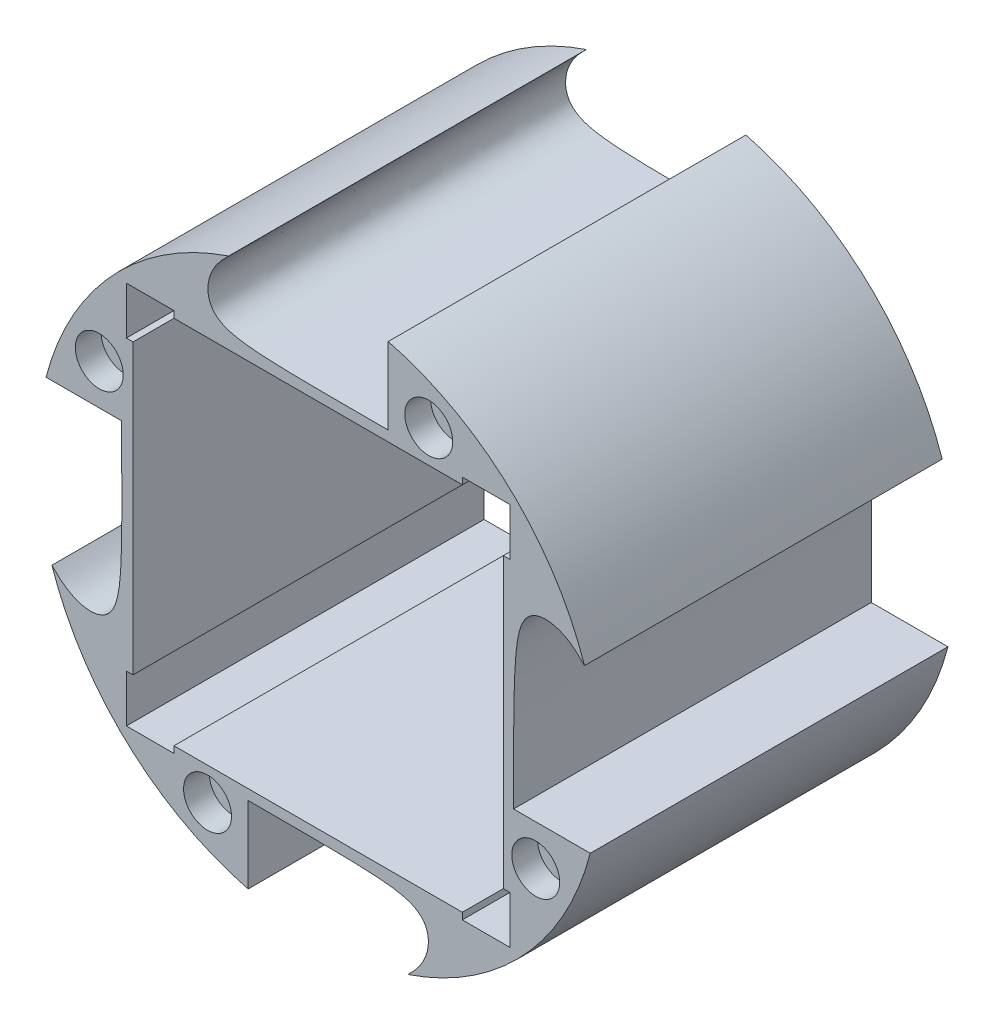
from build123d import *

# Parameters (mm, degrees)
BOSS_EXTRUDE3_OUTLINE_R = 3
BOSS_EXTRUDE3_DEPTH     = 97
SKETCH3_R               = 3
BOSS_EXTRUDE4_DEPTH     = 5
SKETCH3_3_R             = 6.5
CUT_EXTRUDE1_DEPTH      = 7
BOSS_EXTRUDE5_OUTLINE_R = 3
BOSS_EXTRUDE5_DEPTH     = 6
CUT_EXTRUDE2_DEPTH      = 6
SKETCH6_R               = 6.5
CUT_EXTRUDE5_DEPTH      = 7
CUT_EXTRUDE6_DEPTH      = 97
CUT_EXTRUDE9_DEPTH      = 97
SKETCH9_W               = 0.4
SKETCH9_H               = 1.8
SKETCH9_W_2             = 1.8
SKETCH9_H_2             = 0.4
BOSS_EXTRUDE6_DEPTH     = 97


# Read off the part's stored shape, not the designer's step: Boss-Extrude3, Boss-Extrude5, Cut-Extrude2
with BuildPart() as part:
    # Boss-Extrude3 outline → Boss-Extrude3 (new body)
    with BuildSketch(Plane.XY):
        with BuildLine():
            ThreePointArc((-24.28, 72.228260397), (-55.793380191, 51.899313356), (-73.793224621, 19))
            Line((-73.793224621, 19), (-53.359615493, 19))
            add(Edge.make_bspline(
                [(-72.206415586, -24.344887517), (-69.541086329, -27.040667073), (-67.428574969, -29.089162938), (-64.355831171, -30.241441862), (-60.963009895, -31.073643307), (-59.042545022, -30.561519341), (-56.673971678, -29.217193929), (-54.241382838, -27.488775543), (-53, -25.105954954), (-53, -17.37432721), (-53.359615493, 19)],
                knots=[0, 0, 0, 0, 0, 0, 0, 0, 0, 0, 0, 1, 1, 1, 1, 1, 1, 1, 1, 1, 1, 1], degree=10))
            ThreePointArc((-72.206415586, -24.344887517), (-51.874242853, -55.816690411), (-19, -73.793224621))
            Line((-19, -73.793224621), (-19, -53))
            add(Edge.make_bspline(
                [(24.344887517, -72.206415586), (27.040667073, -69.541086329), (29.089162938, -67.428574969), (30.241441862, -64.355831171), (31.073643307, -60.963009895), (30.561519341, -59.042545022), (29.217193929, -56.673971678), (27.488775543, -54.241382838), (25.105954954, -53), (17.37432721, -53), (-19, -53)],
                knots=[0, 0, 0, 0, 0, 0, 0, 0, 0, 0, 0, 1, 1, 1, 1, 1, 1, 1, 1, 1, 1, 1], degree=10))
            ThreePointArc((24.344887517, -72.206415586), (55.816690411, -51.874242853), (73.793224621, -19))
            Line((73.793224621, -19), (53, -19))
            add(Edge.make_bspline(
                [(72.227927536, 24.280990174), (69.541086329, 27.040667073), (67.428574969, 29.089162938), (64.355831171, 30.241441862), (60.963009895, 31.073643307), (59.042545022, 30.561519341), (56.673971678, 29.217193929), (54.241382838, 27.488775543), (53, 25.105954954), (53, 17.37432721), (53, -19)],
                knots=[0, 0, 0, 0, 0, 0, 0, 0, 0, 0, 0, 1, 1, 1, 1, 1, 1, 1, 1, 1, 1, 1], degree=10))
            ThreePointArc((72.227927536, 24.280990174), (51.89893092, 55.793735933), (19, 73.793224621))
            Line((19, 73.793224621), (19, 53))
            add(Edge.make_bspline(
                [(-24.28, 72.228260397), (-27.040667073, 69.541086329), (-29.089162938, 67.428574969), (-30.241441862, 64.355831171), (-31.073643307, 60.963009895), (-30.561519341, 59.042545022), (-29.217193929, 56.673971678), (-27.488775543, 54.241382838), (-25.105954954, 53), (-17.37432721, 53), (19, 53)],
                knots=[0, 0, 0, 0, 0, 0, 0, 0, 0, 0, 0, 1, 1, 1, 1, 1, 1, 1, 1, 1, 1, 1], degree=10))
        make_face()
        with Locations((-30, -59)):
            Circle(BOSS_EXTRUDE3_OUTLINE_R, mode=Mode.SUBTRACT)
        Polygon((-38.9, -51.6), (-51.6, -51.6), (-51.6, -38.9), (-50, -38.9), (-50, 38.9), (-51.6, 38.9), (-51.6, 51.6), (-38.9, 51.6), (-38.9, 50), (38.9, 50), (38.9, 51.6), (51.6, 51.6), (51.6, 38.9), (50, 38.9), (50, -38.9), (51.6, -38.9), (51.6, -51.6), (38.9, -51.6), (38.9, -50), (-38.9, -50), align=None, mode=Mode.SUBTRACT)
        with Locations((59, -30)):
            Circle(BOSS_EXTRUDE3_OUTLINE_R, mode=Mode.SUBTRACT)
        with Locations((-59.359615493, 30)):
            Circle(BOSS_EXTRUDE3_OUTLINE_R, mode=Mode.SUBTRACT)
        with Locations((30, 59)):
            Circle(BOSS_EXTRUDE3_OUTLINE_R, mode=Mode.SUBTRACT)
    extrude(amount=BOSS_EXTRUDE3_DEPTH)

    # Sketch3 → Boss-Extrude4 (add)
    with BuildSketch(Plane.XY.offset(97)):
        with Locations(Location((-59.359615493, 30, 0), (0, 0, 180))):
            Circle(SKETCH3_R)
    extrude(amount=BOSS_EXTRUDE4_DEPTH)


with BuildPart() as boss_extrude4_kept_piece:
    # of the separate pieces the step leaves, the one the design keeps (boss_extrude4_pieces_kept)
    add(part.part.solids().sort_by_distance((-24.28, 72.228260397, 0))[0])

    # Sketch3<3> → Cut-Extrude1 (cut)
    with BuildSketch(Plane.XY.offset(97)):
        with Locations((-59.359615493, 30)):
            Circle(SKETCH3_3_R)
        with Locations((30, 59)):
            Circle(SKETCH3_3_R)
        with Locations((59, -30)):
            Circle(SKETCH3_3_R)
        with Locations((-30, -59)):
            Circle(SKETCH3_3_R)
    extrude(amount=-CUT_EXTRUDE1_DEPTH, mode=Mode.SUBTRACT)

    # Boss-Extrude5 outline → Boss-Extrude5 (add)
    with BuildSketch(Plane.XY):
        with Locations((-59.359615493, 30)):
            Circle(BOSS_EXTRUDE5_OUTLINE_R)
    extrude(amount=BOSS_EXTRUDE5_DEPTH)

    # Cut-Extrude2 outline → Cut-Extrude2 (cut)
    with BuildSketch(Plane.XY):
        Polygon((-32.75, -54.236860279), (-35.5, -59), (-32.75, -63.763139721), (-27.25, -63.763139721), (-24.5, -59), (-27.25, -54.236860279), align=None)
        Polygon((59, -24.5), (54.236860279, -27.25), (54.236860279, -32.75), (59, -35.5), (63.763139721, -32.75), (63.763139721, -27.25), align=None)
        Polygon((-59.359615493, 35.5), (-64.122755214, 32.75), (-64.122755214, 27.25), (-59.359615493, 24.5), (-54.596475772, 27.25), (-54.596475772, 32.75), align=None)
        Polygon((32.75, 63.763139721), (27.25, 63.763139721), (24.5, 59), (27.25, 54.236860279), (32.75, 54.236860279), (35.5, 59), align=None)
    extrude(amount=CUT_EXTRUDE2_DEPTH, mode=Mode.SUBTRACT)

    # Sketch6 → Cut-Extrude5 (cut)
    with BuildSketch(Plane(origin=(0, 0, 0), x_dir=(-1, 0, 0), z_dir=(0, 0, -1))):
        with Locations(Location((-30, 59, 0), (0, 0, 180))):
            Circle(SKETCH6_R)
        with Locations(Location((59.359615493, 30, 0), (0, 0, 180))):
            Circle(SKETCH6_R)
        with Locations(Location((30, -59, 0), (0, 0, 180))):
            Circle(SKETCH6_R)
        with Locations(Location((-59, -30, 0), (0, 0, 180))):
            Circle(SKETCH6_R)
    extrude(amount=-CUT_EXTRUDE5_DEPTH, mode=Mode.SUBTRACT)

    # Sketch7 → Cut-Extrude6 (cut)
    with BuildSketch(Plane.XY.offset(97)):
        Polygon((-38.7, -51.8), (-51.8, -51.8), (-51.8, -38.7), (-50.2, -38.7), (-50.2, 38.7), (-51.8, 38.7), (-51.8, 51.8), (-38.7, 51.8), (-38.7, 50.2), (38.7, 50.2), (38.7, 51.8), (51.8, 51.8), (51.8, 38.7), (50.2, 38.7), (50.2, -38.7), (51.8, -38.7), (51.8, -51.8), (38.7, -51.8), (38.7, -50.2), (-38.7, -50.2), align=None)
        Polygon((-38.9, -51.6), (-51.6, -51.6), (-51.6, -38.9), (-50, -38.9), (-50, 38.9), (-51.6, 38.9), (-51.6, 51.6), (-38.9, 51.6), (-38.9, 50), (38.9, 50), (38.9, 51.6), (51.6, 51.6), (51.6, 38.9), (50, 38.9), (50, -38.9), (51.6, -38.9), (51.6, -51.6), (38.9, -51.6), (38.9, -50), (-38.9, -50), align=None, mode=Mode.SUBTRACT)
    extrude(amount=-CUT_EXTRUDE6_DEPTH, mode=Mode.SUBTRACT)

    # Sketch8 → Cut-Extrude9 (cut)
    with BuildSketch(Plane.XY.offset(97)):
        Polygon((-51.8, 38.7), (-51.8, 51.8), (-38.7, 51.8), (-38.7, 52), (-52, 52), (-52, 38.7), align=None)
        Polygon((-51.8, -38.7), (-51.8, -51.8), (-38.7, -51.8), (-38.7, -52), (-52, -52), (-52, -38.7), align=None)
        Polygon((51.8, -38.7), (51.8, -51.8), (38.7, -51.8), (38.7, -52), (52, -52), (52, -38.7), align=None)
        Polygon((51.8, 38.7), (51.8, 51.8), (38.7, 51.8), (38.7, 52), (52, 52), (52, 38.7), align=None)
    extrude(amount=-CUT_EXTRUDE9_DEPTH, mode=Mode.SUBTRACT)

    # Sketch9 → Boss-Extrude6 (add)
    with BuildSketch(Plane.XY.offset(97)):
        with Locations((-38.9, 51.1)):
            Rectangle(SKETCH9_W, SKETCH9_H)
        with Locations((-51.1, 38.9)):
            Rectangle(SKETCH9_W_2, SKETCH9_H_2)
        with Locations((38.9, 51.1)):
            Rectangle(SKETCH9_W, SKETCH9_H)
        with Locations((51.1, 38.9)):
            Rectangle(SKETCH9_W_2, SKETCH9_H_2)
        with Locations((51.1, -38.9)):
            Rectangle(SKETCH9_W_2, SKETCH9_H_2)
        with Locations((38.9, -51.1)):
            Rectangle(SKETCH9_W, SKETCH9_H)
        with Locations((-51.1, -38.9)):
            Rectangle(SKETCH9_W_2, SKETCH9_H_2)
        with Locations((-38.9, -51.1)):
            Rectangle(SKETCH9_W, SKETCH9_H)
    extrude(amount=-BOSS_EXTRUDE6_DEPTH)


solid = boss_extrude4_kept_piece.part
